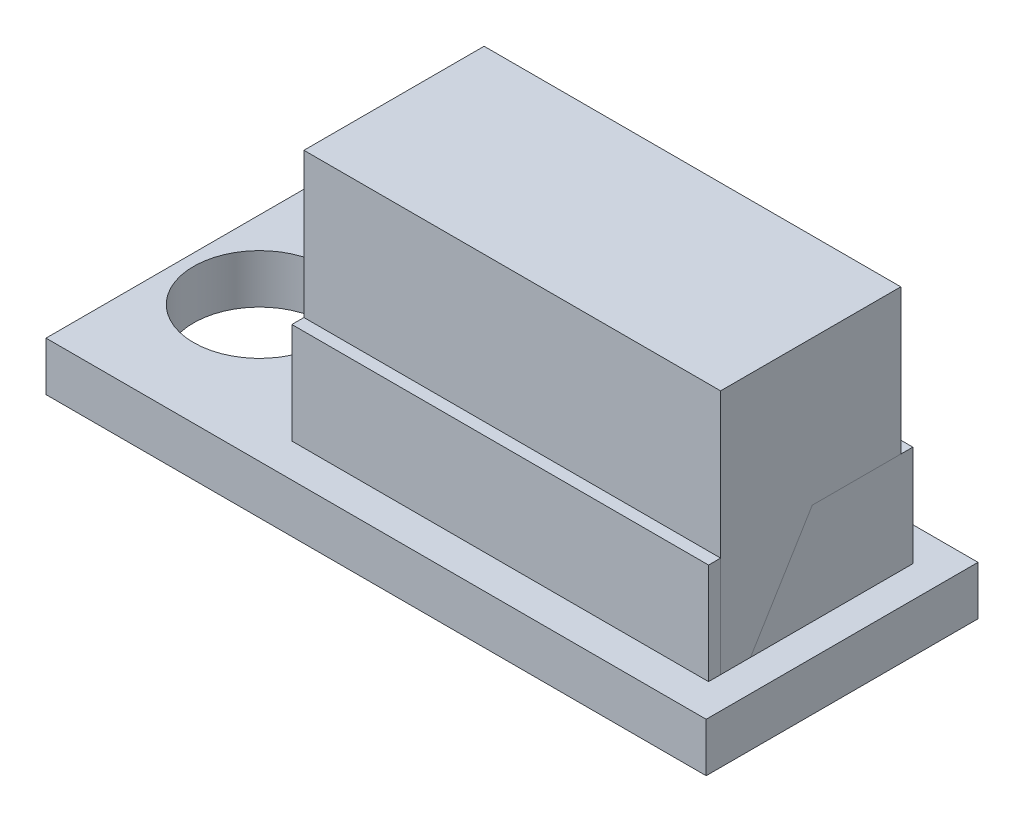
from build123d import *

# Parameters (mm, degrees)
SKETCH1_W           = 21.59
SKETCH1_H           = 8.89
SKETCH1_R           = 2.159
BOSS_EXTRUDE1_DEPTH = 1.6002
SKETCH2_W           = 13.6271
SKETCH2_H           = 6.6802
BOSS_EXTRUDE2_DEPTH = 4.9022
SKETCH3_W           = 13.6271
SKETCH3_H           = 5.8928
BOSS_EXTRUDE3_DEPTH = 9.6393


with BuildPart() as part:
    # Sketch1 → Boss-Extrude1 (new body)
    with BuildSketch(Plane(origin=(0, 0, 0), x_dir=(1, 0, 0), z_dir=(0, 1, 0))):
        with Locations((-40.899991391, -20.536497471)):
            Rectangle(SKETCH1_W, SKETCH1_H)
        with Locations((-49.154991391, -20.536497471)):
            Circle(SKETCH1_R, mode=Mode.SUBTRACT)
    extrude(amount=BOSS_EXTRUDE1_DEPTH)

    # Sketch2 → Boss-Extrude2 (add)
    with BuildSketch(Plane(origin=(0, 0, 0), x_dir=(1, 0, 0), z_dir=(0, 1, 0))):
        with Locations((-37.945014507, -20.536497471)):
            Rectangle(SKETCH2_W, SKETCH2_H)
    extrude(amount=BOSS_EXTRUDE2_DEPTH)


with BuildPart() as body_2:
    # Sketch3 → Boss-Extrude3 (new body)
    with BuildSketch(Plane(origin=(0, 0, 0), x_dir=(1, 0, 0), z_dir=(0, 1, 0))):
        with Locations((-37.945014507, -20.536497471)):
            Rectangle(SKETCH3_W, SKETCH3_H)
    extrude(amount=BOSS_EXTRUDE3_DEPTH)


solid = Compound([part.part, body_2.part])
